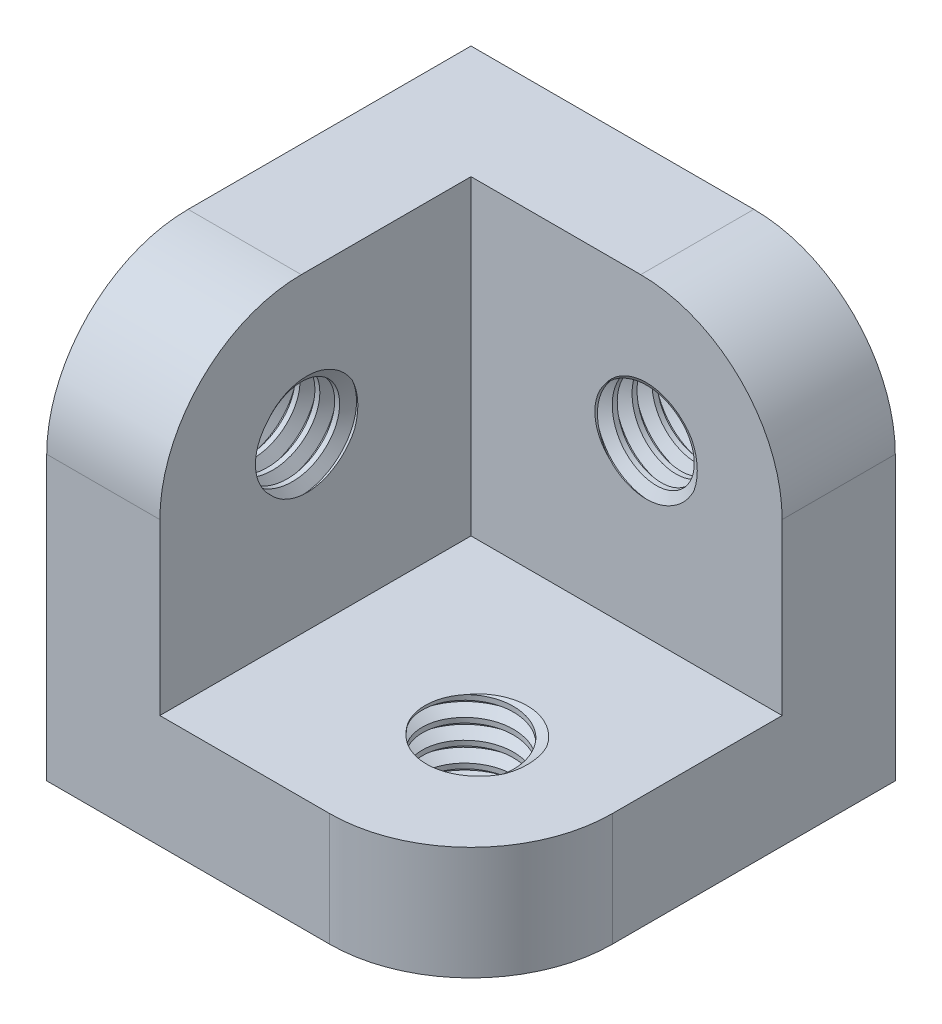
from build123d import *

# Parameters (mm, degrees)
SKETCH1_W                       = 15
SKETCH1_H                       = 15
BOSS_EXTRUDE1_DEPTH             = 15
SKETCH2_W                       = 11
SKETCH2_H                       = 11
CUT_EXTRUDE1_DEPTH              = 11
F_4_0MM_DOWEL_HOLE2_D           = 4
F_4_0MM_DOWEL_HOLE2_ON_FACE_2_D = 4
F_4_0MM_DOWEL_HOLE2_ON_FACE_3_D = 4
FILLET2_R                       = 5
THREAD4_PITCH                   = 0.7
THREAD4_FROM                    = 1
THREAD4_TO                      = 5
THREAD5_PITCH                   = 0.7
THREAD5_FROM                    = 1
THREAD5_TO                      = 5
THREAD6_PITCH                   = 0.7
THREAD6_FROM                    = 1
THREAD6_TO                      = 5


with BuildPart() as part:
    # Sketch1 → Boss-Extrude1 (new body)
    with BuildSketch(Plane(origin=(0, 0, 0), x_dir=(1, 0, 0), z_dir=(0, 1, 0))):
        Rectangle(SKETCH1_W, SKETCH1_H)
    extrude(amount=BOSS_EXTRUDE1_DEPTH)

    # Sketch2 → Cut-Extrude1 (cut)
    with BuildSketch(Plane(origin=(0, 15, 0), x_dir=(1, 0, 0), z_dir=(0, 1, 0))):
        with Locations((2, -2)):
            Rectangle(SKETCH2_W, SKETCH2_H)
    extrude(amount=-CUT_EXTRUDE1_DEPTH, mode=Mode.SUBTRACT)

    # Ø4.0mm Dowel Hole2 (through all)
    with Locations(Plane(origin=(-3.5, 10, 2.5), x_dir=(0, 0, 1), z_dir=(1, 0, 0))):
        with Locations((0, 0)):
            Hole(F_4_0MM_DOWEL_HOLE2_D / 2)

    # Ø4.0mm Dowel Hole2 on face 2 (through all)
    with Locations(Plane(origin=(2.5, 10, -3.5), x_dir=(1, 0, 0), z_dir=(0, 0, 1))):
        with Locations((0, 0)):
            Hole(F_4_0MM_DOWEL_HOLE2_ON_FACE_2_D / 2)

    # Ø4.0mm Dowel Hole2 on face 3 (through all)
    with Locations(Plane(origin=(2.5, 4, 2.5), x_dir=(0, 0, 1), z_dir=(0, 1, 0))):
        with Locations((0, 0)):
            Hole(F_4_0MM_DOWEL_HOLE2_ON_FACE_3_D / 2)

    # Fillet2
    fillet2_edges = [part.edges().sort_by_distance(p)[0] for p in [
        (7.5, 15, -5.5),
        (7.5, 2, 7.5),
        (-5.5, 15, 7.5),
    ]]
    fillet(fillet2_edges, radius=FILLET2_R)

    # Thread4: arcs per turn and ends read off the stored shape
    # Thread4: the profile of Thread Profile6 profile screwed along a right-hand helix through 7.142857 turns, 6 arcs to a turn; built about Z, then put on its axis
    thread4_z = Axis((0, 0, 0), (0, 0, 1))
    thread4_corners = [(2.0003, 0, -0.000173205), (2.0003, 0, 0.612673203), (1.621113887, 0, 0.393749999), (1.621113887, 0, 0.218749999)]
    with BuildLine(mode=Mode.PRIVATE) as thread4_profile:
        Line(thread4_corners[0], thread4_corners[1])
        Line(thread4_corners[1], thread4_corners[2])
        Line(thread4_corners[2], thread4_corners[3])
        Line(thread4_corners[3], thread4_corners[0])
    thread4_cap = Face(thread4_profile.wire())
    thread4_turn_angles = [0, 30, 60, 90, 120, 150, 180, 210, 240, 270, 300, 330, 360]
    thread4_turn_weights = [1, 0.8660254037844387, 1, 0.8660254037844387, 1, 0.8660254037844387, 1, 0.8660254037844387, 1, 0.8660254037844387, 1, 0.8660254037844387, 1]
    thread4_turn_rails = [Edge.make_bspline([Vector(p[0], p[1], 0).rotate(thread4_z, thread4_turn_angles[k]) / thread4_turn_weights[k] + Vector(0, 0, p[2] + THREAD4_PITCH * thread4_turn_angles[k] / 360) for k in range(13)], [0, 0, 0, 1, 1, 2, 2, 3, 3, 4, 4, 5, 5, 6, 6, 6], 2, thread4_turn_weights) for p in thread4_corners]
    thread4_turn_sides = [Face.make_surface_from_curves(thread4_turn_rails[p[0]], thread4_turn_rails[p[1]]) for p in [(0, 1), (1, 2), (2, 3), (3, 0)]]
    thread4_last_angles = [2520, 2545.714285714, 2571.428571429]
    thread4_last_weights = [1, 0.9009688679024135, 1]
    thread4_last_rails = [Edge.make_bspline([Vector(p[0], p[1], 0).rotate(thread4_z, thread4_last_angles[k]) / thread4_last_weights[k] + Vector(0, 0, p[2] + THREAD4_PITCH * thread4_last_angles[k] / 360) for k in range(3)], [0, 0, 0, 1, 1, 1], 2, thread4_last_weights) for p in thread4_corners]
    thread4_last_sides = [Face.make_surface_from_curves(thread4_last_rails[p[0]], thread4_last_rails[p[1]]) for p in [(0, 1), (1, 2), (2, 3), (3, 0)]]
    thread4 = Plane(origin=(2.5, 10, -2.5), x_dir=(-1, 0, 0), z_dir=(0, 0, -1)) * split(split(Solid(Shell([*[p.moved(Location((0, 0, THREAD4_PITCH * i))) for i in range(7) for p in thread4_turn_sides], *thread4_last_sides, thread4_cap, thread4_cap.rotate(thread4_z, 2571.428571429).moved(Location((0, 0, THREAD4_PITCH * 2571.428571429 / 360)))])), bisect_by=Plane.XY.offset(THREAD4_FROM), keep=Keep.TOP, mode=Mode.PRIVATE), bisect_by=Plane.XY.offset(THREAD4_TO), keep=Keep.BOTTOM, mode=Mode.PRIVATE)
    add(thread4)

    # Thread5: arcs per turn and ends read off the stored shape
    # Thread5: the profile of Thread Profile7 profile screwed along a right-hand helix through 7.142857 turns, 6 arcs to a turn; built about Z, then put on its axis
    thread5_z = Axis((0, 0, 0), (0, 0, 1))
    thread5_corners = [(2.0003, 0, -0.000173205), (2.0003, 0, 0.612673203), (1.621113888, 0, 0.393749999), (1.621113888, 0, 0.218749999)]
    with BuildLine(mode=Mode.PRIVATE) as thread5_profile:
        Line(thread5_corners[0], thread5_corners[1])
        Line(thread5_corners[1], thread5_corners[2])
        Line(thread5_corners[2], thread5_corners[3])
        Line(thread5_corners[3], thread5_corners[0])
    thread5_cap = Face(thread5_profile.wire())
    thread5_turn_angles = [0, 30, 60, 90, 120, 150, 180, 210, 240, 270, 300, 330, 360]
    thread5_turn_weights = [1, 0.8660254037844387, 1, 0.8660254037844387, 1, 0.8660254037844387, 1, 0.8660254037844387, 1, 0.8660254037844387, 1, 0.8660254037844387, 1]
    thread5_turn_rails = [Edge.make_bspline([Vector(p[0], p[1], 0).rotate(thread5_z, thread5_turn_angles[k]) / thread5_turn_weights[k] + Vector(0, 0, p[2] + THREAD5_PITCH * thread5_turn_angles[k] / 360) for k in range(13)], [0, 0, 0, 1, 1, 2, 2, 3, 3, 4, 4, 5, 5, 6, 6, 6], 2, thread5_turn_weights) for p in thread5_corners]
    thread5_turn_sides = [Face.make_surface_from_curves(thread5_turn_rails[p[0]], thread5_turn_rails[p[1]]) for p in [(0, 1), (1, 2), (2, 3), (3, 0)]]
    thread5_last_angles = [2520, 2545.714285714, 2571.428571429]
    thread5_last_weights = [1, 0.9009688679024186, 1]
    thread5_last_rails = [Edge.make_bspline([Vector(p[0], p[1], 0).rotate(thread5_z, thread5_last_angles[k]) / thread5_last_weights[k] + Vector(0, 0, p[2] + THREAD5_PITCH * thread5_last_angles[k] / 360) for k in range(3)], [0, 0, 0, 1, 1, 1], 2, thread5_last_weights) for p in thread5_corners]
    thread5_last_sides = [Face.make_surface_from_curves(thread5_last_rails[p[0]], thread5_last_rails[p[1]]) for p in [(0, 1), (1, 2), (2, 3), (3, 0)]]
    thread5 = Plane(origin=(-2.5, 10, 2.5), x_dir=(0, 0, 1), z_dir=(-1, 0, 0)) * split(split(Solid(Shell([*[p.moved(Location((0, 0, THREAD5_PITCH * i))) for i in range(7) for p in thread5_turn_sides], *thread5_last_sides, thread5_cap, thread5_cap.rotate(thread5_z, 2571.428571429).moved(Location((0, 0, THREAD5_PITCH * 2571.428571429 / 360)))])), bisect_by=Plane.XY.offset(THREAD5_FROM), keep=Keep.TOP, mode=Mode.PRIVATE), bisect_by=Plane.XY.offset(THREAD5_TO), keep=Keep.BOTTOM, mode=Mode.PRIVATE)
    add(thread5)

    # Thread6: arcs per turn and ends read off the stored shape
    # Thread6: the profile of Thread Profile8 profile screwed along a right-hand helix through 7.142857 turns, 6 arcs to a turn; built about Z, then put on its axis
    thread6_z = Axis((0, 0, 0), (0, 0, 1))
    thread6_corners = [(2.0003, 0, -0.000173205), (2.0003, 0, 0.612673203), (1.621113887, 0, 0.393749999), (1.621113887, 0, 0.218749999)]
    with BuildLine(mode=Mode.PRIVATE) as thread6_profile:
        Line(thread6_corners[0], thread6_corners[1])
        Line(thread6_corners[1], thread6_corners[2])
        Line(thread6_corners[2], thread6_corners[3])
        Line(thread6_corners[3], thread6_corners[0])
    thread6_cap = Face(thread6_profile.wire())
    thread6_turn_angles = [0, 30, 60, 90, 120, 150, 180, 210, 240, 270, 300, 330, 360]
    thread6_turn_weights = [1, 0.8660254037844387, 1, 0.8660254037844387, 1, 0.8660254037844387, 1, 0.8660254037844387, 1, 0.8660254037844387, 1, 0.8660254037844387, 1]
    thread6_turn_rails = [Edge.make_bspline([Vector(p[0], p[1], 0).rotate(thread6_z, thread6_turn_angles[k]) / thread6_turn_weights[k] + Vector(0, 0, p[2] + THREAD6_PITCH * thread6_turn_angles[k] / 360) for k in range(13)], [0, 0, 0, 1, 1, 2, 2, 3, 3, 4, 4, 5, 5, 6, 6, 6], 2, thread6_turn_weights) for p in thread6_corners]
    thread6_turn_sides = [Face.make_surface_from_curves(thread6_turn_rails[p[0]], thread6_turn_rails[p[1]]) for p in [(0, 1), (1, 2), (2, 3), (3, 0)]]
    thread6_last_angles = [2520, 2545.714285714, 2571.428571429]
    thread6_last_weights = [1, 0.9009688679024186, 1]
    thread6_last_rails = [Edge.make_bspline([Vector(p[0], p[1], 0).rotate(thread6_z, thread6_last_angles[k]) / thread6_last_weights[k] + Vector(0, 0, p[2] + THREAD6_PITCH * thread6_last_angles[k] / 360) for k in range(3)], [0, 0, 0, 1, 1, 1], 2, thread6_last_weights) for p in thread6_corners]
    thread6_last_sides = [Face.make_surface_from_curves(thread6_last_rails[p[0]], thread6_last_rails[p[1]]) for p in [(0, 1), (1, 2), (2, 3), (3, 0)]]
    thread6 = Plane(origin=(2.5, 5, 2.5), x_dir=(-1, 0, 0), z_dir=(0, -1, 0)) * split(split(Solid(Shell([*[p.moved(Location((0, 0, THREAD6_PITCH * i))) for i in range(7) for p in thread6_turn_sides], *thread6_last_sides, thread6_cap, thread6_cap.rotate(thread6_z, 2571.428571429).moved(Location((0, 0, THREAD6_PITCH * 2571.428571429 / 360)))])), bisect_by=Plane.XY.offset(THREAD6_FROM), keep=Keep.TOP, mode=Mode.PRIVATE), bisect_by=Plane.XY.offset(THREAD6_TO), keep=Keep.BOTTOM, mode=Mode.PRIVATE)
    add(thread6)


solid = part.part
